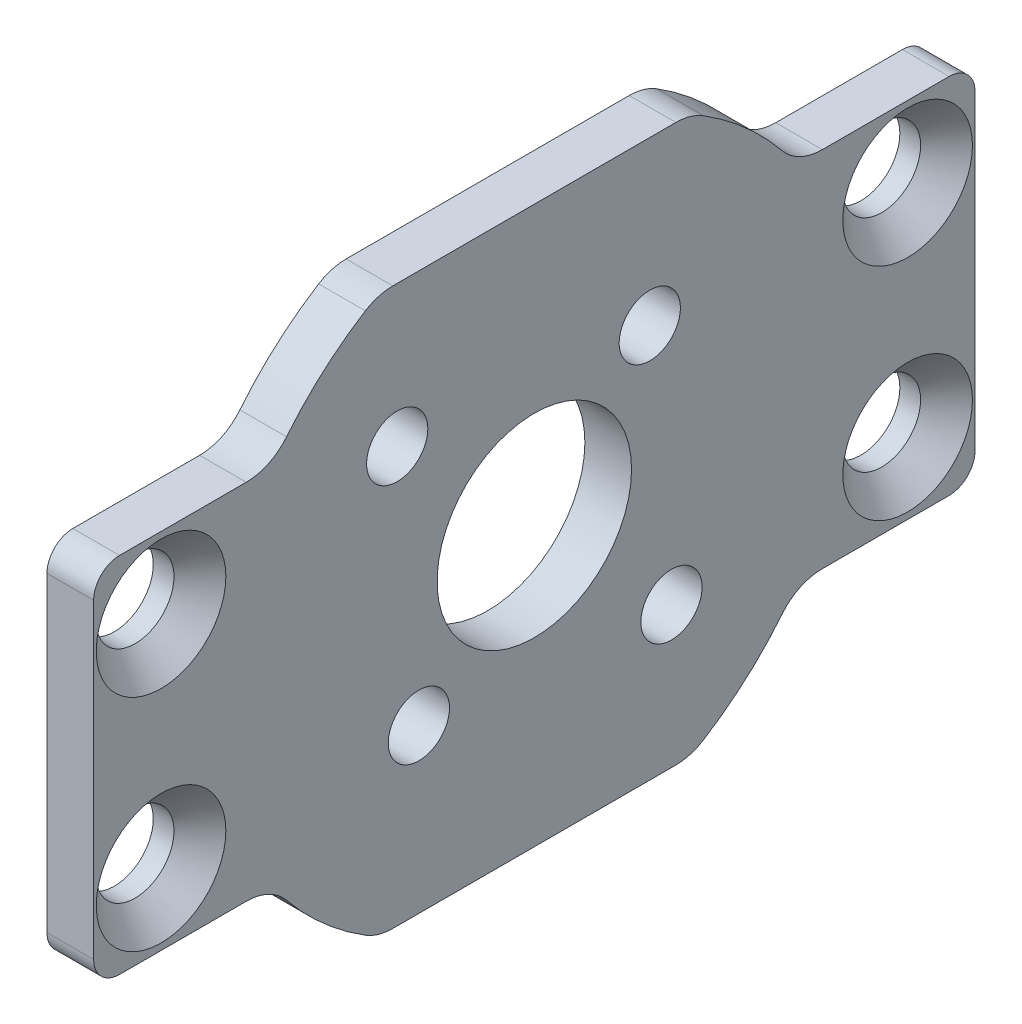
from build123d import *

# Parameters (mm, degrees)
STOCK_DGT_START                               = 10.16
STOCK_DGT_INSIDE_SWERVE_STRUCTURE_SM_2_R      = 1.905
STOCK_DGT_INSIDE_SWERVE_STRUCTURE_SM_2_R_2    = 1.5
STOCK_DGT_INSIDE_SWERVE_STRUCTURE_SM_2_R_3    = 4.7625
STOCK_DGT_INSIDE_SWERVE_STRUCTURE_SMALL_DEPTH = 2.286
CUT_EXTRUDE2_DEPTH                            = 66.309248357
FILLET1_R                                     = 2.54
FILLET2_R                                     = 1.27
CHAMFER1_SIZE                                 = 1.27


# Read off the part's stored shape, not the designer's step: Stock-DGT inside swerve structure Small Bearing-1
with BuildPart() as part:
    # Stock-DGT inside swerve structure Sm 2 → Stock-DGT inside swerve structure Small Bearing-1 (new body)
    with BuildSketch(Plane.YZ.offset(STOCK_DGT_START)):
        with BuildLine():
            ThreePointArc((34.33064, -8.13506567), (36.425690436, -10.904598407), (39.07282, -13.152320138))
            Line((39.07282, -13.152320138), (39.07282, -21.59))
            Line((39.07282, -21.59), (56.85282, -21.59))
            Line((56.85282, -21.59), (56.85282, -13.152320138))
            ThreePointArc((56.85282, -13.152320138), (59.499949564, -10.904598407), (61.595, -8.13506567))
            Line((61.595, -8.13506567), (61.595, 8.13506567))
            ThreePointArc((61.595, 8.13506567), (59.499949564, 10.904598407), (56.85282, 13.152320138))
            Line((56.85282, 13.152320138), (56.85282, 21.59))
            Line((56.85282, 21.59), (39.07282, 21.59))
            Line((39.07282, 21.59), (39.07282, 13.152320138))
            ThreePointArc((39.07282, 13.152320138), (36.425690436, 10.904598407), (34.33064, 8.13506567))
            Line((34.33064, 8.13506567), (34.33064, -8.13506567))
        make_face()
        with Locations((42.56532, -18.288)):
            Circle(STOCK_DGT_INSIDE_SWERVE_STRUCTURE_SM_2_R, mode=Mode.SUBTRACT)
        with Locations((41.245305579, -6.717514421)):
            Circle(STOCK_DGT_INSIDE_SWERVE_STRUCTURE_SM_2_R_2, mode=Mode.SUBTRACT)
        with Locations((53.36032, -18.288)):
            Circle(STOCK_DGT_INSIDE_SWERVE_STRUCTURE_SM_2_R, mode=Mode.SUBTRACT)
        with Locations((53.619674249, -5.656854249)):
            Circle(STOCK_DGT_INSIDE_SWERVE_STRUCTURE_SM_2_R_2, mode=Mode.SUBTRACT)
        with Locations((42.305965751, 5.656854249)):
            Circle(STOCK_DGT_INSIDE_SWERVE_STRUCTURE_SM_2_R_2, mode=Mode.SUBTRACT)
        with Locations((42.56532, 18.288)):
            Circle(STOCK_DGT_INSIDE_SWERVE_STRUCTURE_SM_2_R, mode=Mode.SUBTRACT)
        with Locations((47.96282, 0)):
            Circle(STOCK_DGT_INSIDE_SWERVE_STRUCTURE_SM_2_R_3, mode=Mode.SUBTRACT)
        with Locations((54.680334421, 6.717514421)):
            Circle(STOCK_DGT_INSIDE_SWERVE_STRUCTURE_SM_2_R_2, mode=Mode.SUBTRACT)
        with Locations((53.36032, 18.288)):
            Circle(STOCK_DGT_INSIDE_SWERVE_STRUCTURE_SM_2_R, mode=Mode.SUBTRACT)
    extrude(amount=STOCK_DGT_INSIDE_SWERVE_STRUCTURE_SMALL_DEPTH)

    # Sketch2 → Cut-Extrude2 (cut, through all)
    with BuildSketch(Plane.ZY.offset(-10.16)):
        with BuildLine():
            Line((-12.844591897, 56.85282), (-13.152320138, 56.85282))
            ThreePointArc((-13.152320138, 56.85282), (0, 63.83782), (13.152320138, 56.85282))
            Line((13.152320138, 56.85282), (12.844591897, 56.85282))
            ThreePointArc((12.844591897, 56.85282), (0, 63.58382), (-12.844591897, 56.85282))
        make_face()
        with BuildLine():
            Line((13.152320138, 39.07282), (12.844591897, 39.07282))
            ThreePointArc((12.844591897, 39.07282), (0, 32.34182), (-12.844591897, 39.07282))
            Line((-12.844591897, 39.07282), (-13.152320138, 39.07282))
            ThreePointArc((-13.152320138, 39.07282), (0, 32.08782), (13.152320138, 39.07282))
        make_face()
    extrude(amount=-CUT_EXTRUDE2_DEPTH, mode=Mode.SUBTRACT)

    # Fillet1
    fillet1_edges = [part.edges().sort_by_distance(p)[0] for p in [
        (11.303, 34.33064, 7.627536263),
        (11.303, 34.33064, -7.627536263),
        (11.303, 61.595, -7.627536263),
        (11.303, 61.595, 7.627536263),
        (11.303, 56.85282, 12.844591897),
        (11.303, 56.85282, -12.844591897),
        (11.303, 39.07282, -12.844591897),
        (11.303, 39.07282, 12.844591897),
    ]]
    fillet(fillet1_edges, radius=FILLET1_R)

    # Fillet2
    fillet2_edges = [part.edges().sort_by_distance(p)[0] for p in [
        (11.303, 39.07282, 21.59),
        (11.303, 56.85282, 21.59),
        (11.303, 56.85282, -21.59),
        (11.303, 39.07282, -21.59),
    ]]
    fillet(fillet2_edges, radius=FILLET2_R)

    # Chamfer1
    chamfer1_edges = [part.edges().sort_by_distance(p)[0] for p in [
        (12.446, 51.45532, 18.288),
        (12.446, 40.66032, -18.288),
        (12.446, 51.45532, -18.288),
        (12.446, 40.66032, 18.288),
    ]]
    chamfer(chamfer1_edges, length=CHAMFER1_SIZE)


solid = part.part
